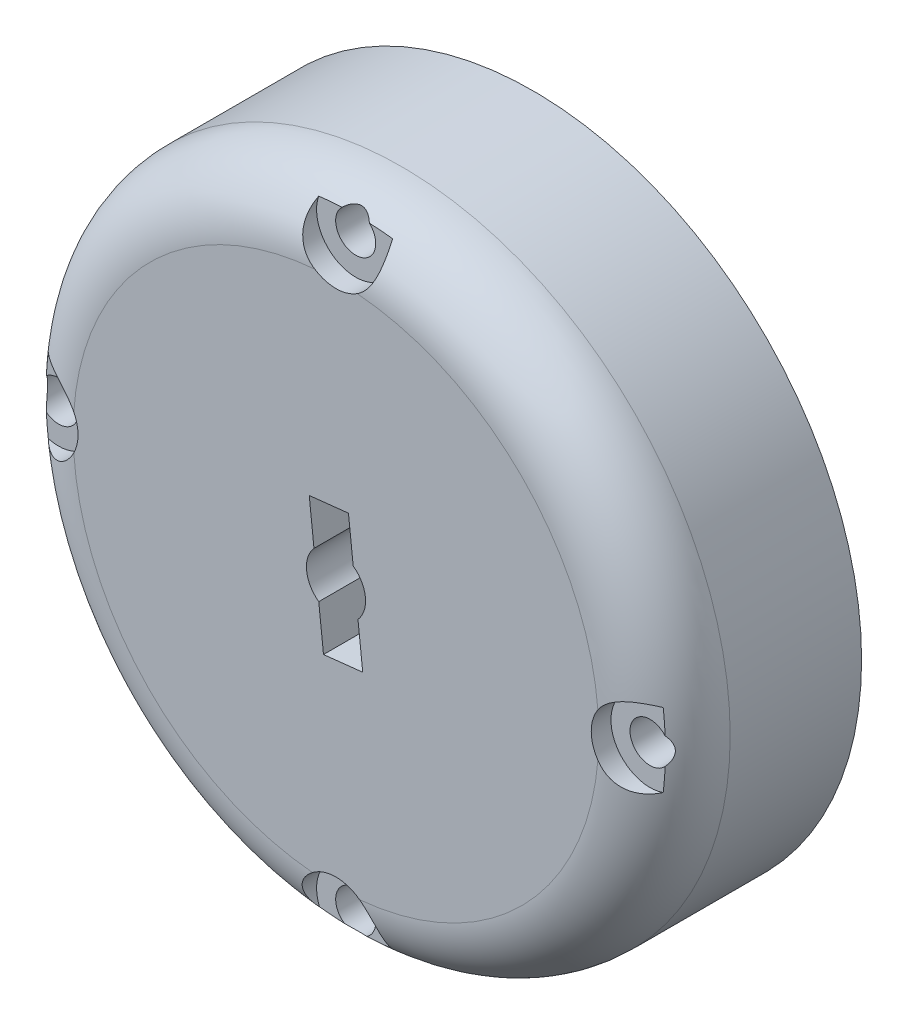
from build123d import *

# Parameters (mm, degrees)
SKETCH1_R                                           = 25
SKETCH1_R_2                                         = 19
BOSS_EXTRUDE1_DEPTH                                 = 5
SKETCH2_R                                           = 25
BOSS_EXTRUDE2_DEPTH                                 = 10
FILLET1_R                                           = 5
CBORE_FOR_3_BINDING_HEAD_MACHINE_SCREW1_D           = 3.048
CBORE_FOR_3_BINDING_HEAD_MACHINE_SCREW1_CBORE_D     = 5.95376
CBORE_FOR_3_BINDING_HEAD_MACHINE_SCREW1_CBORE_DEPTH = 1.4986
CUT_EXTRUDE1_START                                  = -3
CUT_EXTRUDE1_DEPTH                                  = 10
SCALE1_SCALE                                        = 1.5


with BuildPart() as part:
    # Sketch1 → Boss-Extrude1 (new body)
    with BuildSketch(Plane.XY):
        Circle(SKETCH1_R)
        Circle(SKETCH1_R_2, mode=Mode.SUBTRACT)
    extrude(amount=BOSS_EXTRUDE1_DEPTH)

    # Sketch2 → Boss-Extrude2 (add)
    with BuildSketch(Plane.XY.offset(5)):
        Circle(SKETCH2_R)
    extrude(amount=BOSS_EXTRUDE2_DEPTH)

    # Fillet1
    fillet1_edges = [part.edges().sort_by_distance(p)[0] for p in [
        (-25, 0, 15),
        (-19, 0, 5),
    ]]
    fillet(fillet1_edges, radius=FILLET1_R - 0.0001)  # a hair under: the kernel refuses the full size

    # CBORE for #3 Binding Head Machine Screw1 (through all)
    with Locations(Plane.XY.offset(15)):
        with Locations((0, 22.435050854), (0, -22.295918756), (22.400267829, 0), (-22.608965977, 0)):
            CounterBoreHole(CBORE_FOR_3_BINDING_HEAD_MACHINE_SCREW1_D / 2, CBORE_FOR_3_BINDING_HEAD_MACHINE_SCREW1_CBORE_D / 2, CBORE_FOR_3_BINDING_HEAD_MACHINE_SCREW1_CBORE_DEPTH)

    # Sketch15 → Cut-Extrude1 (cut)
    with BuildSketch(Plane(origin=(0, 0, 5), x_dir=(-1, 0, 0), z_dir=(0, 0, -1)).offset(CUT_EXTRUDE1_START)):
        with BuildLine():
            Line((1.676226843, 1.500920907), (2.037127027, 4.807341739))
            Line((2.037127027, 4.807341739), (-0.948609283, 5.133238785))
            Line((-0.948609283, 5.133238785), (-1.309172026, 1.829909453))
            ThreePointArc((-1.309172026, 1.829909453), (-1.94216249, 1.136003901), (-2.236715327, 0.244140421))
            ThreePointArc((-2.236715327, 0.244140421), (-2.141502308, -0.690266516), (-1.673115077, -1.504388892))
            Line((-1.673115077, -1.504388892), (-2.03367782, -4.807718225))
            Line((-2.03367782, -4.807718225), (0.952058491, -5.133615271))
            Line((0.952058491, -5.133615271), (1.312958675, -1.827194439))
            ThreePointArc((1.312958675, -1.827194439), (1.943337692, -1.133992334), (2.236715327, -0.244140421))
            ThreePointArc((2.236715327, -0.244140421), (2.142215878, 0.688048787), (1.676226843, 1.500920907))
        make_face()
    extrude(amount=-CUT_EXTRUDE1_DEPTH, mode=Mode.SUBTRACT)


with BuildPart() as part_1:
    # Scale1: scaled about (-0.000833746, 0.000507816, 8.367914089)
    add(part.part.scale(SCALE1_SCALE).moved(Location((0.000416873, -0.000253908, -4.183957044))))


solid = part_1.part
